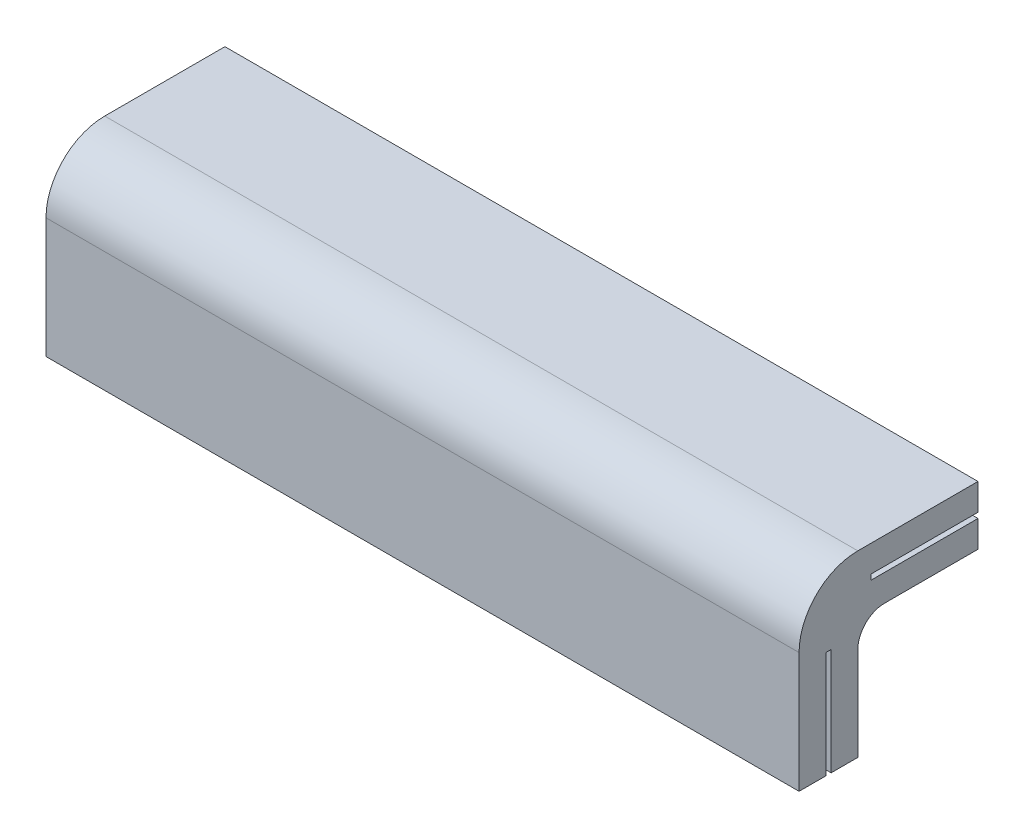
from build123d import *

# Parameters (mm, degrees)
BOSS_EXTRUDE1_DEPTH      = 141
BOSS_EXTRUDE1_DEPTH_BACK = 141
CAVITY1_START            = -2
CAVITY1_OUTLINE_W        = 282
CAVITY1_OUTLINE_H        = 40
CAVITY1_DEPTH            = 2


# Read off the part's stored shape, not the designer's step: Cavity1
with BuildPart() as part:
    # Sketch2 → Boss-Extrude1 (new, two sides: drawn at the far end of the back side and taken through both)
    with BuildSketch(Plane(origin=(0, 0, 0), x_dir=(0, 0, -1), z_dir=(1, 0, 0)).offset(-BOSS_EXTRUDE1_DEPTH_BACK)):
        with BuildLine():
            Line((12, 220), (12, 185))
            Line((12, 185), (-10, 185))
            Line((-10, 185), (-10, 230))
            ThreePointArc((-10, 230), (-3.556349186, 245.556349186), (12, 252))
            Line((12, 252), (57, 252))
            Line((57, 252), (57, 242))
            Line((57, 242), (17, 242))
            Line((17, 242), (17, 240))
            Line((17, 240), (57, 240))
            Line((57, 240), (57, 230))
            Line((57, 230), (22, 230))
            ThreePointArc((22, 230), (14.928932188, 227.071067812), (12, 220))
        make_face()
    extrude(amount=BOSS_EXTRUDE1_DEPTH + BOSS_EXTRUDE1_DEPTH_BACK)

    # Cavity1 outline → Cavity1 (cut)
    with BuildSketch(Plane.XY.offset(CAVITY1_START)):
        with Locations((0, 205)):
            Rectangle(CAVITY1_OUTLINE_W, CAVITY1_OUTLINE_H)
    extrude(amount=CAVITY1_DEPTH, mode=Mode.SUBTRACT)


solid = part.part
